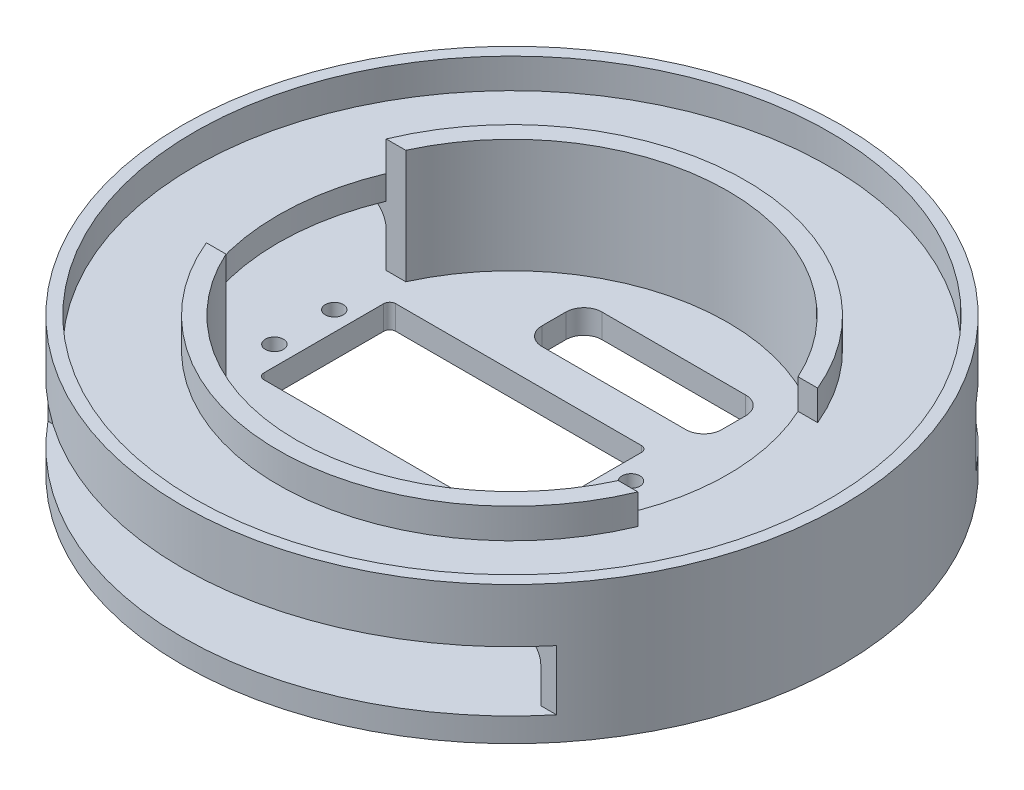
from build123d import *
from build123d.topology import SkipClean

# Parameters (mm, degrees)
SKETCH_1_R          = 55.00000000000001
EXTRUDE_1_DEPTH     = 4
EXTRUDE_2_DEPTH     = 10
SKETCH_3_R          = 1.499999999999999
SKETCH_3_R_2        = 1.500000000000004
CUT_EXTRUDE_1_DEPTH = 6
FILLET_1_R          = 1
EXTRUDE_3_DEPTH     = 10
SKETCH_5_R          = 55.00000000000001
SKETCH_5_R_2        = 36
EXTRUDE_4_DEPTH     = 4
SKETCH_6_R          = 55.00000000000001
SKETCH_6_R_2        = 53
EXTRUDE_5_DEPTH     = 5
CUT_EXTRUDE_START   = -4
CUT_EXTRUDE_2_DEPTH = 4
FILLET_2_R          = 4
CUT_EXTRUDE_3_DEPTH = 10
FILLET_3_R          = 3


with BuildPart() as part:
    # 草图1 → 凸台-拉伸1 (new body)
    with BuildSketch(Plane(origin=(0, 0, 0), x_dir=(1, 0, 0), z_dir=(0, 1, 0))):
        with Locations(Location((0, 0, 0), (0, 0, 270))):
            Circle(SKETCH_1_R)
    extrude(amount=EXTRUDE_1_DEPTH)

    # 草图2 → 凸台-拉伸2 (add)
    with BuildSketch(Plane(origin=(0, 4, 0), x_dir=(1, 0, 0), z_dir=(0, 1, 0))):
        with BuildLine():
            Line((-39.799497484264805, 35), (-42.42640687119287, 35))
            ThreePointArc((-42.42640687119286, 35.000000000000014), (-55.000000000000014, 6.74e-15), (-42.42640687119287, -35))
            Line((-42.42640687119284, -35), (-39.799497484264776, -35))
            ThreePointArc((-39.79949748426479, -35.00000000000001), (-53, 6.49e-15), (-39.799497484264805, 35))
        make_face()
        with BuildLine():
            ThreePointArc((55.000000000000014, 0), (51.76124215045274, 18.59499424689872), (42.426406871192874, 35))
            Line((42.42640687119287, 35), (39.799497484264805, 35))
            ThreePointArc((39.799497484264805, 35), (49.59018736940825, 18.703296946447246), (53, 0))
            ThreePointArc((53, -1.298e-14), (49.590187369408234, -18.703296946447267), (39.799497484264776, -35.00000000000002))
            Line((39.799497484264776, -35), (42.42640687119284, -35))
            ThreePointArc((42.42640687119285, -35.00000000000002), (51.76124215045274, -18.594994246898718), (55.000000000000014, -1.347e-14))
        make_face()
    extrude(amount=EXTRUDE_2_DEPTH)

    # 草图3 → 切除-拉伸1 (cut)
    with BuildSketch(Plane.XZ):
        with Locations(Location((14.85, 5, 0), (0, 0, 270))):
            Circle(SKETCH_3_R)
        with Locations(Location((14.85, -5, 0), (0, 0, 90))):
            Circle(SKETCH_3_R)
        with Locations(Location((-34.65, 5, 0), (0, 0, 270))):
            Circle(SKETCH_3_R_2)
        with Locations(Location((-34.65, -5, 0), (0, 0, 90))):
            Circle(SKETCH_3_R_2)
        Polygon((-31.4, -10.999999999999996), (11.599999999999998, -10.999999999999996), (11.599999999999994, 11.000000000000004), (-31.4, 11.000000000000004), align=None)
    extrude(amount=-CUT_EXTRUDE_1_DEPTH, mode=Mode.SUBTRACT)

    # 圆角1
    fillet_1_edges = [part.edges().sort_by_distance(p)[0] for p in [
        (11.599999999999994, 2, 11.000000000000004),
        (11.599999999999998, 2, -10.999999999999996),
        (-31.4, 2, -10.999999999999996),
        (-31.4, 2, 11.000000000000004),
    ]]
    fillet(fillet_1_edges, radius=FILLET_1_R)

    # 草图4 → 凸台-拉伸3 (add)
    with BuildSketch(Plane(origin=(0, 4, 0), x_dir=(1, 0, 0), z_dir=(0, 1, 0))):
        with BuildLine():
            ThreePointArc((-32.72613634390714, 14.999999999999996), (-5.79e-15, 36), (32.72613634390714, 14.999999999999996))
            Line((32.72613634390714, 14.999999999999996), (36.00000000000001, 14.999999999999996))
            ThreePointArc((36, 14.999999999999995), (2.39e-15, 39), (-36, 14.999999999999998))
            Line((-36.00000000000001, 14.999999999999996), (-32.72613634390714, 14.999999999999996))
        make_face()
        with BuildLine():
            Line((36, -15.000000000000014), (32.726136343907136, -15.000000000000014))
            ThreePointArc((32.72613634390713, -15.000000000000028), (-6.61e-15, -36), (-32.726136343907136, -15.000000000000016))
            Line((-32.726136343907136, -15.000000000000014), (-36, -15.000000000000014))
            ThreePointArc((-36, -15.000000000000005), (-7.16e-15, -39), (35.99999999999999, -15.000000000000018))
        make_face()
    extrude(amount=EXTRUDE_3_DEPTH)

    # 草图5 → 凸台-拉伸4 (add)
    with SkipClean():  # the faces are left unmerged after this step: merging them gives an invalid solid
        with BuildSketch(Plane(origin=(0, 14, 0), x_dir=(1, 0, 0), z_dir=(0, 1, 0))):
            with Locations(Location((0, 0, 0), (0, 0, 270))):
                Circle(SKETCH_5_R)
            with Locations(Location((0, 0, 0), (0, 0, 155.375681648))):
                Circle(SKETCH_5_R_2, mode=Mode.SUBTRACT)
        extrude(amount=EXTRUDE_4_DEPTH)

    # 草图6 → 凸台-拉伸5 (add)
    # profile 1 of 3: a face of its own
    with SkipClean():  # the faces are left unmerged after this step: merging them gives an invalid solid
        with BuildSketch(Plane(origin=(0, 18.000000000000004, 0), x_dir=(1, 0, 0), z_dir=(0, 1, 0))):
            with Locations(Location((0, 0, 0), (0, 0, 270))):
                Circle(SKETCH_6_R)
            with Locations(Location((0, 0, 0), (0, 0, 270))):
                Circle(SKETCH_6_R_2, mode=Mode.SUBTRACT)
        # profile 2 of 3: a face of its own
        with BuildSketch(Plane(origin=(0, 18.000000000000004, 0), x_dir=(1, 0, 0), z_dir=(0, 1, 0))):
            with BuildLine():
                Line((-36.00000000000001, 14.999999999999996), (-32.72613634390714, 14.999999999999996))
                ThreePointArc((-32.72613634390714, 14.999999999999996), (-5.79e-15, 36), (32.72613634390714, 14.999999999999996))
                Line((32.72613634390714, 14.999999999999996), (36.00000000000001, 14.999999999999996))
                ThreePointArc((36, 14.999999999999995), (2.39e-15, 39), (-36, 14.999999999999998))
            make_face()
        # profile 3 of 3: a face of its own
        with BuildSketch(Plane(origin=(0, 18.000000000000004, 0), x_dir=(1, 0, 0), z_dir=(0, 1, 0))):
            with BuildLine():
                Line((36, -15.000000000000014), (32.726136343907136, -15.000000000000014))
                ThreePointArc((32.72613634390713, -15.000000000000028), (-6.61e-15, -36), (-32.726136343907136, -15.000000000000016))
                Line((-32.726136343907136, -15.000000000000014), (-36, -15.000000000000014))
                ThreePointArc((-36, -15.000000000000005), (-7.16e-15, -39), (35.99999999999999, -15.000000000000018))
            make_face()
        extrude(amount=EXTRUDE_5_DEPTH)

    # 草图7 → 切除-拉伸2 (cut)
    with BuildSketch(Plane(origin=(0, 18.000000000000004, 0), x_dir=(1, 0, 0), z_dir=(0, 1, 0)).offset(CUT_EXTRUDE_START)):
        with BuildLine():
            ThreePointArc((-36, -15.000000000000014), (-39.00000000000001, -4.78e-15), (-36.00000000000001, 14.999999999999996))
            Line((-36.00000000000001, 14.999999999999996), (-32.72613634390714, 14.999999999999996))
            ThreePointArc((-32.72613634390714, 14.999999999999996), (-36, -2.04e-14), (-32.726136343907136, -15.000000000000014))
            Line((-32.726136343907136, -15.000000000000014), (-36, -15.000000000000014))
        make_face()
    extrude(amount=CUT_EXTRUDE_2_DEPTH, mode=Mode.SUBTRACT)

    # 圆角2
    # the kernel refuses this fillet: 4 mm, written as the material it adds along each edge
    with BuildSketch(Plane(origin=(-3.55e-15, 14, -5.33e-15), x_dir=(0.9904724769404064, 0, -0.13771082899879708), z_dir=(0.13771082899879708, 0, 0.9904724769404064))) as fillet_2_piece_1_section:
        with BuildLine():
            CenterArc((39 + FILLET_2_R, -FILLET_2_R), FILLET_2_R, 90, 90)
            Line((39 + FILLET_2_R, 0), (39, 0))
            Line((39, 0), (38.99999999999999, -FILLET_2_R))
        make_face()
    fillet_2_piece_1 = revolve(axis=Axis((-3.55e-15, 14, -5.33e-15), (0, 1, 0)), revolution_arc=164.16919327842925, mode=Mode.PRIVATE)
    fillet_2_piece_1 = split(fillet_2_piece_1, bisect_by=Plane(origin=(0, 12.877029486971129, -14.999999999999996), z_dir=(0, 0, -1)), keep=Keep.TOP, mode=Mode.PRIVATE)
    add(fillet_2_piece_1)
    with BuildSketch(Plane(origin=(3.55e-15, 14, -8.88e-15), x_dir=(-0.9904724769404064, 0, 0.13771082899879786), z_dir=(-0.13771082899879786, 0, -0.9904724769404064))) as fillet_2_piece_2_section:
        with BuildLine():
            CenterArc((38.99999999999986 + FILLET_2_R, -FILLET_2_R), FILLET_2_R, 90, 90)
            Line((38.99999999999986, -FILLET_2_R), (38.99999999999986, 0))
            Line((38.99999999999986, 0), (38.99999999999986 + FILLET_2_R, 0))
        make_face()
    fillet_2_piece_2 = revolve(axis=Axis((3.55e-15, 14, -8.88e-15), (0, 1, 0)), revolution_arc=164.16919327842916, mode=Mode.PRIVATE)
    fillet_2_piece_2 = split(fillet_2_piece_2, bisect_by=Plane(origin=(-7.11e-15, 12.877029483112029, 15.000000000000014), z_dir=(0, 0, 1)), keep=Keep.TOP, mode=Mode.PRIVATE)
    add(fillet_2_piece_2)
    with BuildSketch(Plane(origin=(-4.263e-14, 14, -1.865e-14), x_dir=(0.6136949496452997, 0, 0.7895432279361612), z_dir=(-0.7895432279361612, 0, 0.6136949496452997))) as fillet_2_piece_3_section:
        with BuildLine():
            CenterArc((53.00000000000012 - FILLET_2_R, -FILLET_2_R), FILLET_2_R, 0, 90)
            Line((53.00000000000012, -FILLET_2_R), (53.00000000000012, 0))
            Line((53.00000000000012, 0), (53.00000000000012 - FILLET_2_R, 0))
        make_face()
    fillet_2_piece_3 = revolve(axis=Axis((-4.263e-14, 14, -1.865e-14), (0, 1, 0)), revolution_arc=104.28569181085327, mode=Mode.PRIVATE)
    fillet_2_piece_3 = split(fillet_2_piece_3, bisect_by=Plane(origin=(51.873764077248, 12.873764077247905, -35), z_dir=(0, 0, 1)), keep=Keep.TOP, mode=Mode.PRIVATE)
    fillet_2_piece_3 = split(fillet_2_piece_3, bisect_by=Plane(origin=(51.873764077248, 12.873764077247905, 35), z_dir=(0, 0, -1)), keep=Keep.TOP, mode=Mode.PRIVATE)
    add(fillet_2_piece_3)
    with BuildSketch(Plane(origin=(-1.421e-14, 14, -7.11e-15), x_dir=(-0.6136949496452995, 0, 0.7895432279361616), z_dir=(0.7895432279361616, 0, 0.6136949496452995))) as fillet_2_piece_4_section:
        with BuildLine():
            CenterArc((53.00000000000001 - FILLET_2_R, FILLET_2_R), FILLET_2_R, 270, 90)
            Line((53.00000000000001, FILLET_2_R), (53.00000000000001, 0))
            Line((53.00000000000001, 0), (53.00000000000001 - FILLET_2_R, 0))
        make_face()
    fillet_2_piece_4 = revolve(axis=Axis((-1.421e-14, 14, -7.11e-15), (0, -1, 0)), revolution_arc=104.28569181085335, mode=Mode.PRIVATE)
    fillet_2_piece_4 = split(fillet_2_piece_4, bisect_by=Plane(origin=(-51.87376407724794, 12.873764077247902, -35), z_dir=(0, 0, 1)), keep=Keep.TOP, mode=Mode.PRIVATE)
    fillet_2_piece_4 = split(fillet_2_piece_4, bisect_by=Plane(origin=(-51.87376407724794, 12.873764077247902, 35), z_dir=(0, 0, -1)), keep=Keep.TOP, mode=Mode.PRIVATE)
    add(fillet_2_piece_4)

    # 草图8 → 切除-拉伸3 (cut)
    with BuildSketch(Plane(origin=(0, 4, 0), x_dir=(1, 0, 0), z_dir=(0, 1, 0))):
        Polygon((-14.999999999999998, -27), (15.000000000000002, -27), (15.000000000000004, -16.999999999999996), (-14.999999999999996, -16.999999999999996), align=None)
        Polygon((-14.999999999999996, 16.999999999999996), (15.000000000000004, 16.999999999999996), (15.000000000000002, 27), (-14.999999999999998, 27), align=None)
    extrude(amount=-CUT_EXTRUDE_3_DEPTH, mode=Mode.SUBTRACT)

    # 圆角3
    fillet_3_edges = [part.edges().sort_by_distance(p)[0] for p in [
        (15.000000000000002, 2, -27),
        (15.000000000000004, 2, -16.999999999999996),
        (-14.999999999999996, 2, -16.999999999999996),
        (-14.999999999999998, 2, -27),
        (-14.999999999999998, 2, 27),
        (-14.999999999999996, 2, 16.999999999999996),
        (15.000000000000004, 2, 16.999999999999996),
        (15.000000000000002, 2, 27),
    ]]
    fillet(fillet_3_edges, radius=FILLET_3_R)


solid = part.part
